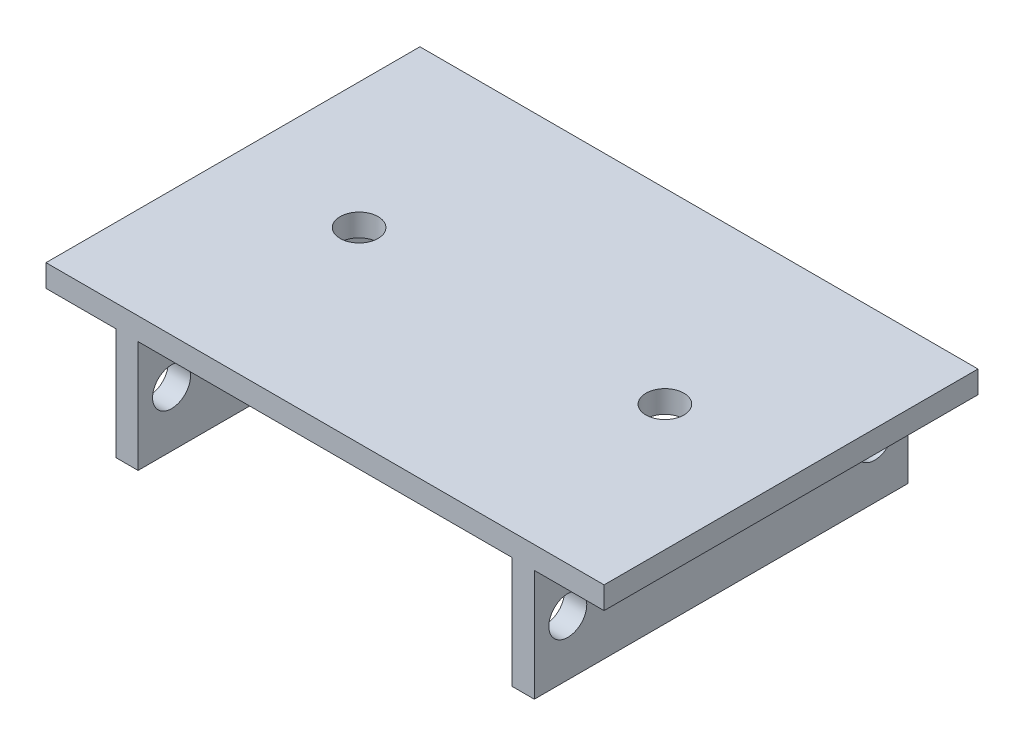
from build123d import *

# Parameters (mm, degrees)
SKETCH1_W                          = 50
SKETCH1_H                          = 33.5
BOSS_EXTRUDE1_DEPTH                = 2
SKETCH6_W                          = 2
SKETCH6_H                          = 33.5
BOSS_EXTRUDE2_DEPTH                = 10
M3_CLEARANCE_HOLE3_D               = 3.4
M3_CLEARANCE_HOLE3_DEPTH           = 10
M3_CLEARANCE_HOLE3_TIP             = 1.021463052
M3_CLEARANCE_HOLE3_ON_FACE_2_D     = 3.4
M3_CLEARANCE_HOLE3_ON_FACE_2_DEPTH = 10
M3_CLEARANCE_HOLE3_ON_FACE_2_TIP   = 1.021463052
M3_CLEARANCE_HOLE4_D               = 3.4


with BuildPart() as part:
    # Sketch1 → Boss-Extrude1 (new body)
    with BuildSketch(Plane(origin=(0, 0, 0), x_dir=(1, 0, 0), z_dir=(0, 1, 0))):
        with Locations((-47.186085356, 13.7444519)):
            Rectangle(SKETCH1_W, SKETCH1_H)
    extrude(amount=BOSS_EXTRUDE1_DEPTH)

    # Sketch6 → Boss-Extrude2 (add)
    with BuildSketch(Plane(origin=(0, 0, 0), x_dir=(1, 0, 0), z_dir=(0, 1, 0))):
        with Locations((-64.936085356, 13.7444519)):
            Rectangle(SKETCH6_W, SKETCH6_H)
        with Locations((-29.436085356, 13.7444519)):
            Rectangle(SKETCH6_W, SKETCH6_H)
    extrude(amount=-BOSS_EXTRUDE2_DEPTH)

    # M3 Clearance Hole3
    with Locations(Plane(origin=(-65.936085356, -5, -27.4944519), x_dir=(0, 0, -1), z_dir=(-1, 0, 0))):
        with Locations((0, 0), (-27.5, 0)):
            Hole(M3_CLEARANCE_HOLE3_D / 2, depth=M3_CLEARANCE_HOLE3_DEPTH)
            with Locations((0, 0, -(M3_CLEARANCE_HOLE3_DEPTH + M3_CLEARANCE_HOLE3_TIP / 2))):  # 118° drill point
                Cone(0, M3_CLEARANCE_HOLE3_D / 2, M3_CLEARANCE_HOLE3_TIP, mode=Mode.SUBTRACT)

    # M3 Clearance Hole3 on face 2
    with Locations(Plane(origin=(-28.436085356, -5, -27.4944519), x_dir=(0, 0, 1), z_dir=(1, 0, 0))):
        with Locations((0, 0), (27.5, 0)):
            Hole(M3_CLEARANCE_HOLE3_ON_FACE_2_D / 2, depth=M3_CLEARANCE_HOLE3_ON_FACE_2_DEPTH)
            with Locations((0, 0, -(M3_CLEARANCE_HOLE3_ON_FACE_2_DEPTH + M3_CLEARANCE_HOLE3_ON_FACE_2_TIP / 2))):  # 118° drill point
                Cone(0, M3_CLEARANCE_HOLE3_ON_FACE_2_D / 2, M3_CLEARANCE_HOLE3_ON_FACE_2_TIP, mode=Mode.SUBTRACT)

    # M3 Clearance Hole4 (through all)
    with Locations(Plane(origin=(0, 0, 0), x_dir=(-1, 0, 0), z_dir=(0, -1, 0))):
        with Locations((33.486085356, 13.7444519), (60.886085356, 13.7444519)):
            Hole(M3_CLEARANCE_HOLE4_D / 2)


solid = part.part
